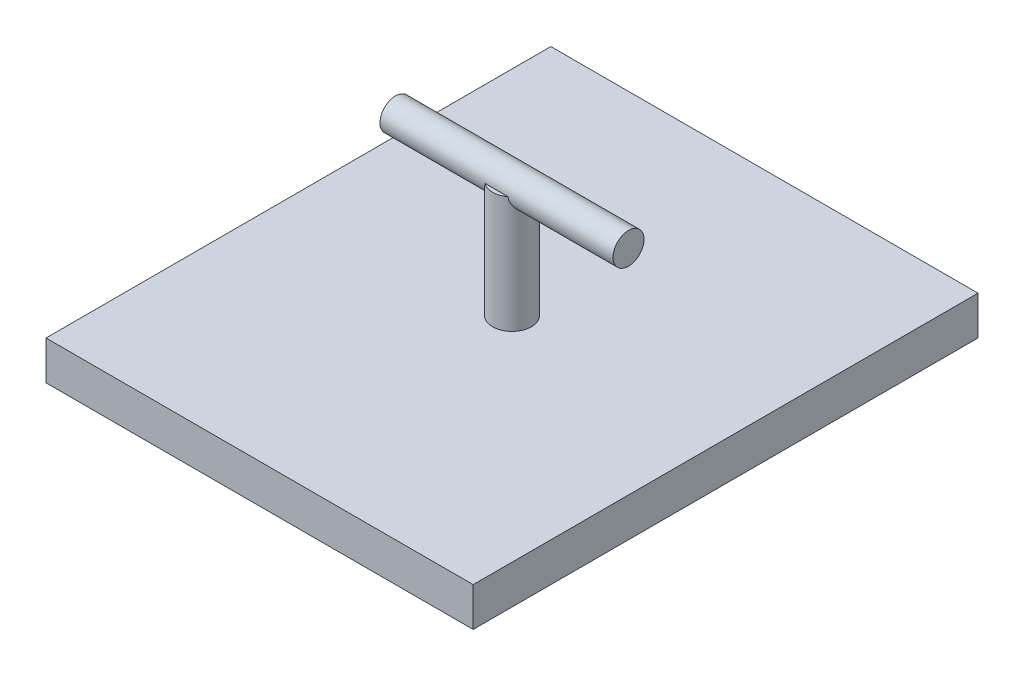
from build123d import *

# Parameters (mm, degrees)
SKETCH_1_W      = 60
SKETCH_1_H      = 4
SKETCH_3_R      = 5
EXTRUDE_2_DEPTH = 30
SKETCH_5_W      = 110
SKETCH_5_H      = 130
EXTRUDE_3_DEPTH = 10


with BuildPart() as part:
    # 草图1 → 旋转3 (revolve)
    with BuildSketch(Plane(origin=(0, 0, 0), x_dir=(1, 0, 0), z_dir=(0, 1, 0))):
        with Locations((0, 2)):
            Rectangle(SKETCH_1_W, SKETCH_1_H)
    revolve(axis=Axis((-30, 0, 0), (1, 0, 0)))

    # 草图3 → 凸台-拉伸2 (add)
    with BuildSketch(Plane(origin=(0, 0, 0), x_dir=(1, 0, 0), z_dir=(0, 1, 0))):
        Circle(SKETCH_3_R)
    extrude(amount=-EXTRUDE_2_DEPTH)

    # 草图5 → 凸台-拉伸3 (add)
    with BuildSketch(Plane.XZ.offset(30)):
        Rectangle(SKETCH_5_W, SKETCH_5_H)
    extrude(amount=EXTRUDE_3_DEPTH)


solid = part.part
